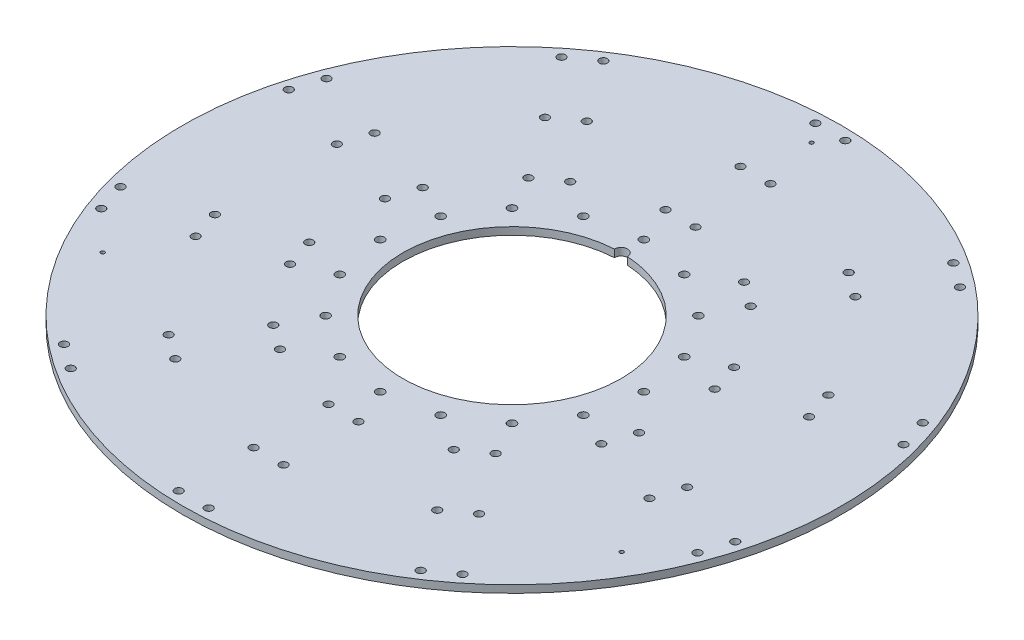
from build123d import *

# Parameters (mm, degrees)
BOSS_EXTRUDE1_OUTLINE_R   = 558.8
BOSS_EXTRUDE1_OUTLINE_R_2 = 6.746875
BOSS_EXTRUDE1_OUTLINE_R_3 = 7
BOSS_EXTRUDE1_DEPTH       = 12.7
SKETCH2_R                 = 3.2639
CUT_EXTRUDE1_DEPTH        = 791.364580431


# Read off the part's stored shape, not the designer's step: Boss-Extrude1
with BuildPart() as part:
    # Boss-Extrude1 outline → Boss-Extrude1 (new body)
    with BuildSketch(Plane(origin=(0, 0, 0), x_dir=(1, 0, 0), z_dir=(0, 1, 0))):
        Circle(BOSS_EXTRUDE1_OUTLINE_R)
        with Locations((-337.806121582, -421.737177306)):
            Circle(BOSS_EXTRUDE1_OUTLINE_R_2, mode=Mode.SUBTRACT)
        with Locations((-296.708058268, -451.596668122)):
            Circle(BOSS_EXTRUDE1_OUTLINE_R_2, mode=Mode.SUBTRACT)
        with Locations((-25.4, -539.75)):
            Circle(BOSS_EXTRUDE1_OUTLINE_R_2, mode=Mode.SUBTRACT)
        with Locations((-263.157394541, -318.99201902)):
            Circle(BOSS_EXTRUDE1_OUTLINE_R_2, mode=Mode.SUBTRACT)
        with Locations((-222.059331227, -348.851509836)):
            Circle(BOSS_EXTRUDE1_OUTLINE_R_2, mode=Mode.SUBTRACT)
        with Locations((-25.4, -412.75)):
            Circle(BOSS_EXTRUDE1_OUTLINE_R_2, mode=Mode.SUBTRACT)
        with Locations((-25.4, -285.75)):
            Circle(BOSS_EXTRUDE1_OUTLINE_R_2, mode=Mode.SUBTRACT)
        with Locations((-505.483723013, -190.948758228)):
            Circle(BOSS_EXTRUDE1_OUTLINE_R_2, mode=Mode.SUBTRACT)
        with Locations((-521.181786327, -142.6350872)):
            Circle(BOSS_EXTRUDE1_OUTLINE_R_2, mode=Mode.SUBTRACT)
        with Locations((-384.699545444, -151.703599942)):
            Circle(BOSS_EXTRUDE1_OUTLINE_R_2, mode=Mode.SUBTRACT)
        with Locations((-400.397608758, -103.389928914)):
            Circle(BOSS_EXTRUDE1_OUTLINE_R_2, mode=Mode.SUBTRACT)
        with Locations((-279.613431188, -64.144770629)):
            Circle(BOSS_EXTRUDE1_OUTLINE_R_2, mode=Mode.SUBTRACT)
        with Locations((-147.410604185, -246.106351551)):
            Circle(BOSS_EXTRUDE1_OUTLINE_R_2, mode=Mode.SUBTRACT)
        with Locations((-188.5086675, -216.246860734)):
            Circle(BOSS_EXTRUDE1_OUTLINE_R_2, mode=Mode.SUBTRACT)
        with Locations((-158.038139321, -158.038139321)):
            Circle(BOSS_EXTRUDE1_OUTLINE_R_3, mode=Mode.SUBTRACT)
        with Locations((-85.529624675, -206.486779875)):
            Circle(BOSS_EXTRUDE1_OUTLINE_R_3, mode=Mode.SUBTRACT)
        with Locations((-263.915367874, -112.458441657)):
            Circle(BOSS_EXTRUDE1_OUTLINE_R_2, mode=Mode.SUBTRACT)
        with Locations((-206.486779875, -85.529624675)):
            Circle(BOSS_EXTRUDE1_OUTLINE_R_3, mode=Mode.SUBTRACT)
        with Locations((25.4, -539.75)):
            Circle(BOSS_EXTRUDE1_OUTLINE_R_2, mode=Mode.SUBTRACT)
        with Locations((25.4, -412.75)):
            Circle(BOSS_EXTRUDE1_OUTLINE_R_2, mode=Mode.SUBTRACT)
        with Locations((25.4, -285.75)):
            Circle(BOSS_EXTRUDE1_OUTLINE_R_2, mode=Mode.SUBTRACT)
        with Locations((222.059331227, -348.851509836)):
            Circle(BOSS_EXTRUDE1_OUTLINE_R_2, mode=Mode.SUBTRACT)
        with Locations((263.157394541, -318.99201902)):
            Circle(BOSS_EXTRUDE1_OUTLINE_R_2, mode=Mode.SUBTRACT)
        with Locations((296.708058268, -451.596668122)):
            Circle(BOSS_EXTRUDE1_OUTLINE_R_2, mode=Mode.SUBTRACT)
        with Locations((337.806121582, -421.737177306)):
            Circle(BOSS_EXTRUDE1_OUTLINE_R_2, mode=Mode.SUBTRACT)
        with Locations((0, -223.49968)):
            Circle(BOSS_EXTRUDE1_OUTLINE_R_3, mode=Mode.SUBTRACT)
        with Locations((85.529624675, -206.486779875)):
            Circle(BOSS_EXTRUDE1_OUTLINE_R_3, mode=Mode.SUBTRACT)
        with Locations((147.410604185, -246.106351551)):
            Circle(BOSS_EXTRUDE1_OUTLINE_R_2, mode=Mode.SUBTRACT)
        with Locations((188.5086675, -216.246860734)):
            Circle(BOSS_EXTRUDE1_OUTLINE_R_2, mode=Mode.SUBTRACT)
        with Locations((158.038139321, -158.038139321)):
            Circle(BOSS_EXTRUDE1_OUTLINE_R_3, mode=Mode.SUBTRACT)
        with Locations((206.486779875, -85.529624675)):
            Circle(BOSS_EXTRUDE1_OUTLINE_R_3, mode=Mode.SUBTRACT)
        with Locations((263.915367874, -112.458441657)):
            Circle(BOSS_EXTRUDE1_OUTLINE_R_2, mode=Mode.SUBTRACT)
        with Locations((384.699545444, -151.703599942)):
            Circle(BOSS_EXTRUDE1_OUTLINE_R_2, mode=Mode.SUBTRACT)
        with Locations((505.483723013, -190.948758228)):
            Circle(BOSS_EXTRUDE1_OUTLINE_R_2, mode=Mode.SUBTRACT)
        with Locations((521.181786327, -142.6350872)):
            Circle(BOSS_EXTRUDE1_OUTLINE_R_2, mode=Mode.SUBTRACT)
        with Locations((400.397608758, -103.389928914)):
            Circle(BOSS_EXTRUDE1_OUTLINE_R_2, mode=Mode.SUBTRACT)
        with Locations((279.613431188, -64.144770629)):
            Circle(BOSS_EXTRUDE1_OUTLINE_R_2, mode=Mode.SUBTRACT)
        with Locations((-279.613431188, 64.144770629)):
            Circle(BOSS_EXTRUDE1_OUTLINE_R_2, mode=Mode.SUBTRACT)
        with Locations((-400.397608758, 103.389928914)):
            Circle(BOSS_EXTRUDE1_OUTLINE_R_2, mode=Mode.SUBTRACT)
        with Locations((-521.181786327, 142.6350872)):
            Circle(BOSS_EXTRUDE1_OUTLINE_R_2, mode=Mode.SUBTRACT)
        with Locations((-505.483723013, 190.948758228)):
            Circle(BOSS_EXTRUDE1_OUTLINE_R_2, mode=Mode.SUBTRACT)
        with Locations((-384.699545444, 151.703599942)):
            Circle(BOSS_EXTRUDE1_OUTLINE_R_2, mode=Mode.SUBTRACT)
        with Locations((-223.49968, 0)):
            Circle(BOSS_EXTRUDE1_OUTLINE_R_3, mode=Mode.SUBTRACT)
        with Locations((-263.915367874, 112.458441657)):
            Circle(BOSS_EXTRUDE1_OUTLINE_R_2, mode=Mode.SUBTRACT)
        with Locations((-206.486779875, 85.529624675)):
            Circle(BOSS_EXTRUDE1_OUTLINE_R_3, mode=Mode.SUBTRACT)
        with Locations((-158.038139321, 158.038139321)):
            Circle(BOSS_EXTRUDE1_OUTLINE_R_3, mode=Mode.SUBTRACT)
        with Locations((-188.5086675, 216.246860734)):
            Circle(BOSS_EXTRUDE1_OUTLINE_R_2, mode=Mode.SUBTRACT)
        with Locations((-147.410604185, 246.106351551)):
            Circle(BOSS_EXTRUDE1_OUTLINE_R_2, mode=Mode.SUBTRACT)
        with Locations((-85.529624675, 206.486779875)):
            Circle(BOSS_EXTRUDE1_OUTLINE_R_3, mode=Mode.SUBTRACT)
        with Locations((-337.806121582, 421.737177306)):
            Circle(BOSS_EXTRUDE1_OUTLINE_R_2, mode=Mode.SUBTRACT)
        with Locations((-296.708058268, 451.596668122)):
            Circle(BOSS_EXTRUDE1_OUTLINE_R_2, mode=Mode.SUBTRACT)
        with Locations((-263.157394541, 318.99201902)):
            Circle(BOSS_EXTRUDE1_OUTLINE_R_2, mode=Mode.SUBTRACT)
        with Locations((-222.059331227, 348.851509836)):
            Circle(BOSS_EXTRUDE1_OUTLINE_R_2, mode=Mode.SUBTRACT)
        with Locations((-25.4, 285.75)):
            Circle(BOSS_EXTRUDE1_OUTLINE_R_2, mode=Mode.SUBTRACT)
        with Locations((-25.4, 412.75)):
            Circle(BOSS_EXTRUDE1_OUTLINE_R_2, mode=Mode.SUBTRACT)
        with Locations((-25.4, 539.75)):
            Circle(BOSS_EXTRUDE1_OUTLINE_R_2, mode=Mode.SUBTRACT)
        with BuildLine():
            ThreePointArc((10.995849972, 184.672930565), (0, -185), (-10.995849972, 184.672930565))
            ThreePointArc((-10.995849972, 184.672930565), (0, 196.00164), (10.995849972, 184.672930565))
        make_face(mode=Mode.SUBTRACT)
        with Locations((223.49968, 0)):
            Circle(BOSS_EXTRUDE1_OUTLINE_R_3, mode=Mode.SUBTRACT)
        with Locations((206.486779875, 85.529624675)):
            Circle(BOSS_EXTRUDE1_OUTLINE_R_3, mode=Mode.SUBTRACT)
        with Locations((263.915367874, 112.458441657)):
            Circle(BOSS_EXTRUDE1_OUTLINE_R_2, mode=Mode.SUBTRACT)
        with Locations((85.529624675, 206.486779875)):
            Circle(BOSS_EXTRUDE1_OUTLINE_R_3, mode=Mode.SUBTRACT)
        with Locations((0, 223.49968)):
            Circle(BOSS_EXTRUDE1_OUTLINE_R_3, mode=Mode.SUBTRACT)
        with Locations((158.038139321, 158.038139321)):
            Circle(BOSS_EXTRUDE1_OUTLINE_R_3, mode=Mode.SUBTRACT)
        with Locations((188.5086675, 216.246860734)):
            Circle(BOSS_EXTRUDE1_OUTLINE_R_2, mode=Mode.SUBTRACT)
        with Locations((147.410604185, 246.106351551)):
            Circle(BOSS_EXTRUDE1_OUTLINE_R_2, mode=Mode.SUBTRACT)
        with Locations((279.613431188, 64.144770629)):
            Circle(BOSS_EXTRUDE1_OUTLINE_R_2, mode=Mode.SUBTRACT)
        with Locations((400.397608758, 103.389928914)):
            Circle(BOSS_EXTRUDE1_OUTLINE_R_2, mode=Mode.SUBTRACT)
        with Locations((384.699545444, 151.703599942)):
            Circle(BOSS_EXTRUDE1_OUTLINE_R_2, mode=Mode.SUBTRACT)
        with Locations((521.181786327, 142.6350872)):
            Circle(BOSS_EXTRUDE1_OUTLINE_R_2, mode=Mode.SUBTRACT)
        with Locations((505.483723013, 190.948758228)):
            Circle(BOSS_EXTRUDE1_OUTLINE_R_2, mode=Mode.SUBTRACT)
        with Locations((25.4, 285.75)):
            Circle(BOSS_EXTRUDE1_OUTLINE_R_2, mode=Mode.SUBTRACT)
        with Locations((25.4, 412.75)):
            Circle(BOSS_EXTRUDE1_OUTLINE_R_2, mode=Mode.SUBTRACT)
        with Locations((222.059331227, 348.851509836)):
            Circle(BOSS_EXTRUDE1_OUTLINE_R_2, mode=Mode.SUBTRACT)
        with Locations((263.157394541, 318.99201902)):
            Circle(BOSS_EXTRUDE1_OUTLINE_R_2, mode=Mode.SUBTRACT)
        with Locations((25.4, 539.75)):
            Circle(BOSS_EXTRUDE1_OUTLINE_R_2, mode=Mode.SUBTRACT)
        with Locations((296.708058268, 451.596668122)):
            Circle(BOSS_EXTRUDE1_OUTLINE_R_2, mode=Mode.SUBTRACT)
        with Locations((337.806121582, 421.737177306)):
            Circle(BOSS_EXTRUDE1_OUTLINE_R_2, mode=Mode.SUBTRACT)
    extrude(amount=BOSS_EXTRUDE1_DEPTH)

    # Sketch2 → Cut-Extrude1 (cut, through all)
    with BuildSketch(Plane(origin=(0, 12.7, 0), x_dir=(1, 0, 0), z_dir=(0, 1, 0))):
        with Locations(Location((0, 508, 0), (0, 0, 270))):
            Circle(SKETCH2_R)
        with Locations(Location((-439.940905122, -254, 0), (0, 0, 270))):
            Circle(SKETCH2_R)
        with Locations(Location((439.940905122, -254, 0), (0, 0, 270))):
            Circle(SKETCH2_R)
    extrude(amount=-CUT_EXTRUDE1_DEPTH, mode=Mode.SUBTRACT)


solid = part.part
